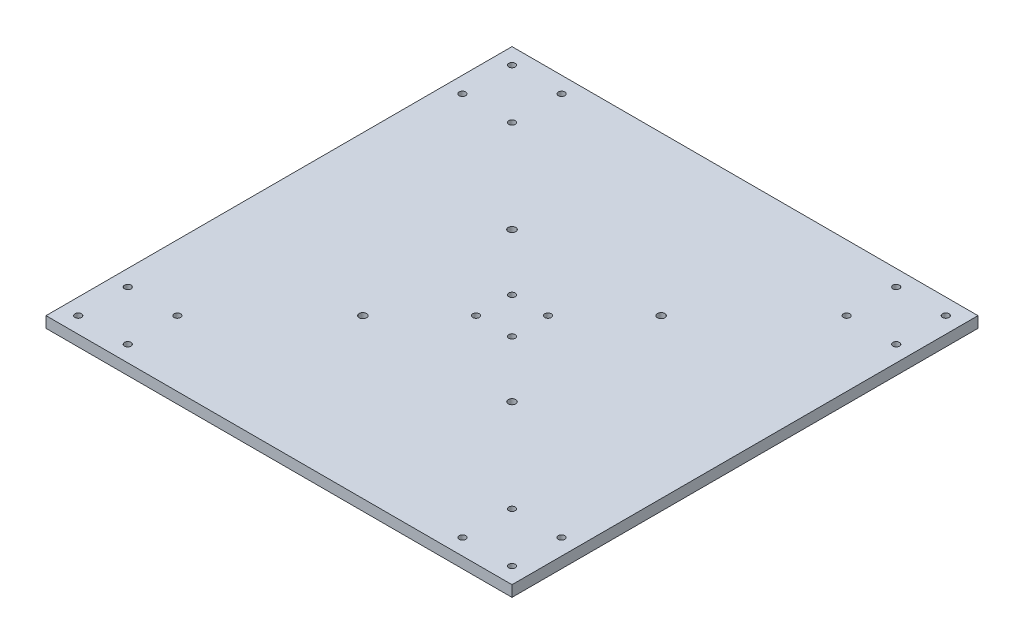
from build123d import *

# Parameters (mm, degrees)
SKETCH1_W           = 253.263754636
SKETCH1_H           = 253.263754636
SKETCH1_R           = 1.778
SKETCH1_R_2         = 2.032
BOSS_EXTRUDE1_DEPTH = 5.9944


with BuildPart() as part:
    # Sketch1 → Boss-Extrude1 (new body)
    with BuildSketch(Plane(origin=(0, 0, 0), x_dir=(1, 0, 0), z_dir=(0, 1, 0))):
        Rectangle(SKETCH1_W, SKETCH1_H)
        with Locations((-117.881577318, -117.881577318)):
            Circle(SKETCH1_R, mode=Mode.SUBTRACT)
        with Locations((-90.932177318, -117.881577318)):
            Circle(SKETCH1_R, mode=Mode.SUBTRACT)
        with Locations((-117.881577318, -90.932177318)):
            Circle(SKETCH1_R, mode=Mode.SUBTRACT)
        with Locations((-90.932177318, -90.932177318)):
            Circle(SKETCH1_R, mode=Mode.SUBTRACT)
        with Locations((90.932177318, -117.881577318)):
            Circle(SKETCH1_R, mode=Mode.SUBTRACT)
        with Locations((117.881577318, -117.881577318)):
            Circle(SKETCH1_R, mode=Mode.SUBTRACT)
        with Locations((90.932177318, -90.932177318)):
            Circle(SKETCH1_R, mode=Mode.SUBTRACT)
        with Locations((117.881577318, -90.932177318)):
            Circle(SKETCH1_R, mode=Mode.SUBTRACT)
        with Locations((90.932177318, 90.932177318)):
            Circle(SKETCH1_R, mode=Mode.SUBTRACT)
        with Locations((117.881577318, 90.932177318)):
            Circle(SKETCH1_R, mode=Mode.SUBTRACT)
        with Locations((90.932177318, 117.881577318)):
            Circle(SKETCH1_R, mode=Mode.SUBTRACT)
        with Locations((117.881577318, 117.881577318)):
            Circle(SKETCH1_R, mode=Mode.SUBTRACT)
        with Locations((-117.881577318, 90.932177318)):
            Circle(SKETCH1_R, mode=Mode.SUBTRACT)
        with Locations((-90.932177318, 90.932177318)):
            Circle(SKETCH1_R, mode=Mode.SUBTRACT)
        with Locations((-117.881577318, 117.881577318)):
            Circle(SKETCH1_R, mode=Mode.SUBTRACT)
        with Locations((-90.932177318, 117.881577318)):
            Circle(SKETCH1_R, mode=Mode.SUBTRACT)
        with Locations((-9.779, -9.779)):
            Circle(SKETCH1_R, mode=Mode.SUBTRACT)
        with Locations((-40.513, 40.513)):
            Circle(SKETCH1_R_2, mode=Mode.SUBTRACT)
        with Locations((40.513, 40.513)):
            Circle(SKETCH1_R_2, mode=Mode.SUBTRACT)
        with Locations((-40.513, -40.513)):
            Circle(SKETCH1_R_2, mode=Mode.SUBTRACT)
        with Locations((40.513, -40.513)):
            Circle(SKETCH1_R_2, mode=Mode.SUBTRACT)
        with Locations((9.779, -9.779)):
            Circle(SKETCH1_R, mode=Mode.SUBTRACT)
        with Locations((-9.779, 9.779)):
            Circle(SKETCH1_R, mode=Mode.SUBTRACT)
        with Locations((9.779, 9.779)):
            Circle(SKETCH1_R, mode=Mode.SUBTRACT)
    extrude(amount=BOSS_EXTRUDE1_DEPTH)


solid = part.part
